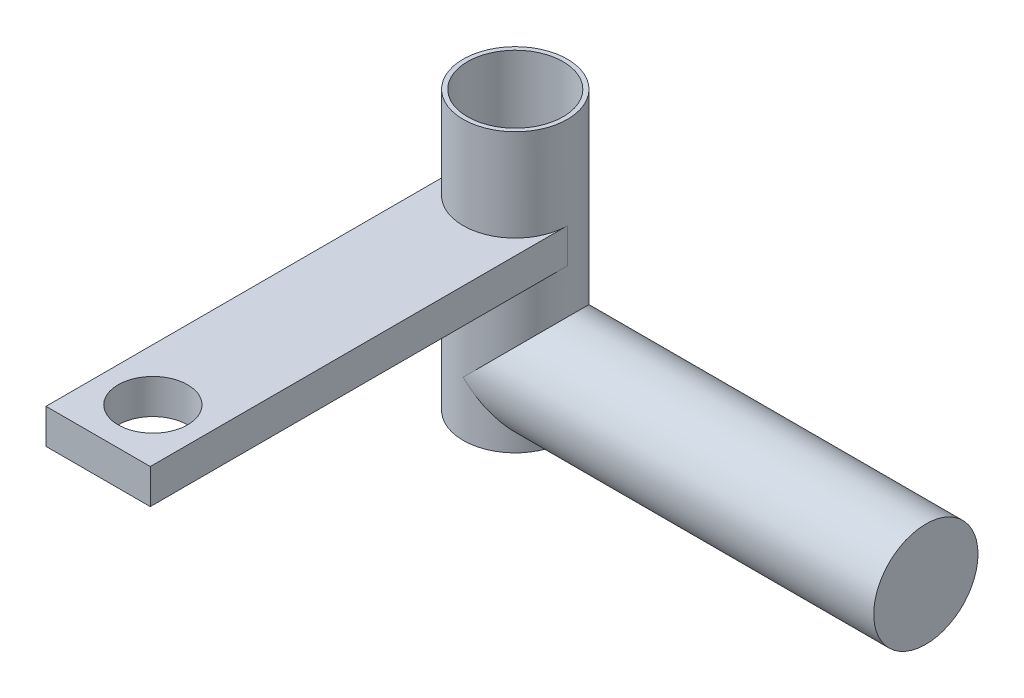
from build123d import *

# Parameters (mm, degrees)
SKETCH1_R          = 9.525
SLEEVE_DEPTH       = 50.8
SKETCH2_W          = 19.05
SKETCH2_H          = 6.35
BRACKET_DEPTH      = 76.2
SKETCH4_R          = 6.35
BRACKET_HOLE_DEPTH = 93.075
SKETCH5_R          = 9.525
SHAFT_DEPTH        = 75
SKETCH6_R          = 8.73125
SLEEVE_HOLE_DEPTH  = 119.372631972


with BuildPart() as part:
    # Sketch1 → Sleeve (new body)
    with BuildSketch(Plane(origin=(0, 0, 0), x_dir=(1, 0, 0), z_dir=(0, 1, 0))):
        Circle(SKETCH1_R)
    extrude(amount=SLEEVE_DEPTH)

    # Sketch2 → Bracket (add)
    with BuildSketch(Plane.XY):
        with Locations((0, 30.8)):
            Rectangle(SKETCH2_W, SKETCH2_H)
    extrude(amount=BRACKET_DEPTH)

    # Sketch4 → Bracket Hole (cut, through all)
    with BuildSketch(Plane(origin=(0, 0, 0), x_dir=(1, 0, 0), z_dir=(0, 1, 0))):
        with Locations((0, -66.2)):
            Circle(SKETCH4_R)
    extrude(amount=BRACKET_HOLE_DEPTH, mode=Mode.SUBTRACT)

    # Sketch5 → Shaft (add)
    with BuildSketch(Plane(origin=(0, 0, 0), x_dir=(0, 0, -1), z_dir=(1, 0, 0))):
        with Locations((0, 10)):
            Circle(SKETCH5_R)
    extrude(amount=SHAFT_DEPTH)

    # Sketch6 → Sleeve Hole (cut, through all)
    with BuildSketch(Plane(origin=(0, 0, 0), x_dir=(1, 0, 0), z_dir=(0, 1, 0))):
        Circle(SKETCH6_R)
    extrude(amount=SLEEVE_HOLE_DEPTH, mode=Mode.SUBTRACT)


solid = part.part
